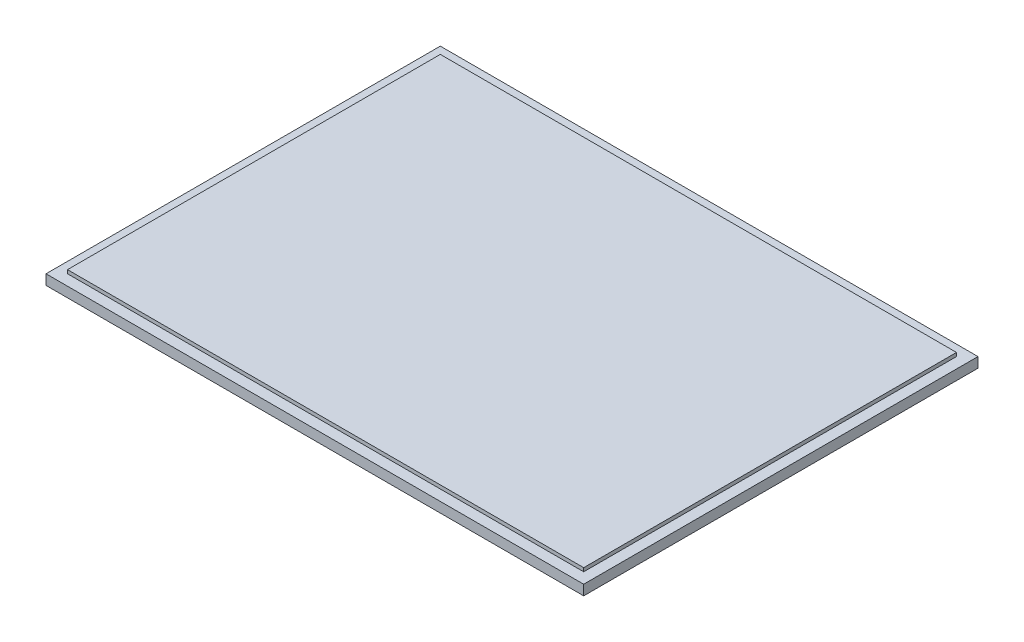
from build123d import *

# Parameters (mm, degrees)
SKETCH1_W           = 750
SKETCH1_H           = 550
BOSS_EXTRUDE1_DEPTH = 19.1
SKETCH3_W           = 750
SKETCH3_H           = 550
SKETCH3_W_2         = 720
SKETCH3_H_2         = 520
CUT_EXTRUDE2_DEPTH  = 5


with BuildPart() as part:
    # Sketch1 → Boss-Extrude1 (new body)
    with BuildSketch(Plane(origin=(0, 0, 0), x_dir=(1, 0, 0), z_dir=(0, 1, 0))):
        Rectangle(SKETCH1_W, SKETCH1_H)
    extrude(amount=BOSS_EXTRUDE1_DEPTH)

    # Sketch3 → Cut-Extrude2 (cut)
    with BuildSketch(Plane(origin=(0, 19.1, 0), x_dir=(1, 0, 0), z_dir=(0, 1, 0))):
        Rectangle(SKETCH3_W, SKETCH3_H)
        Rectangle(SKETCH3_W_2, SKETCH3_H_2, mode=Mode.SUBTRACT)
    extrude(amount=-CUT_EXTRUDE2_DEPTH, mode=Mode.SUBTRACT)


solid = part.part
